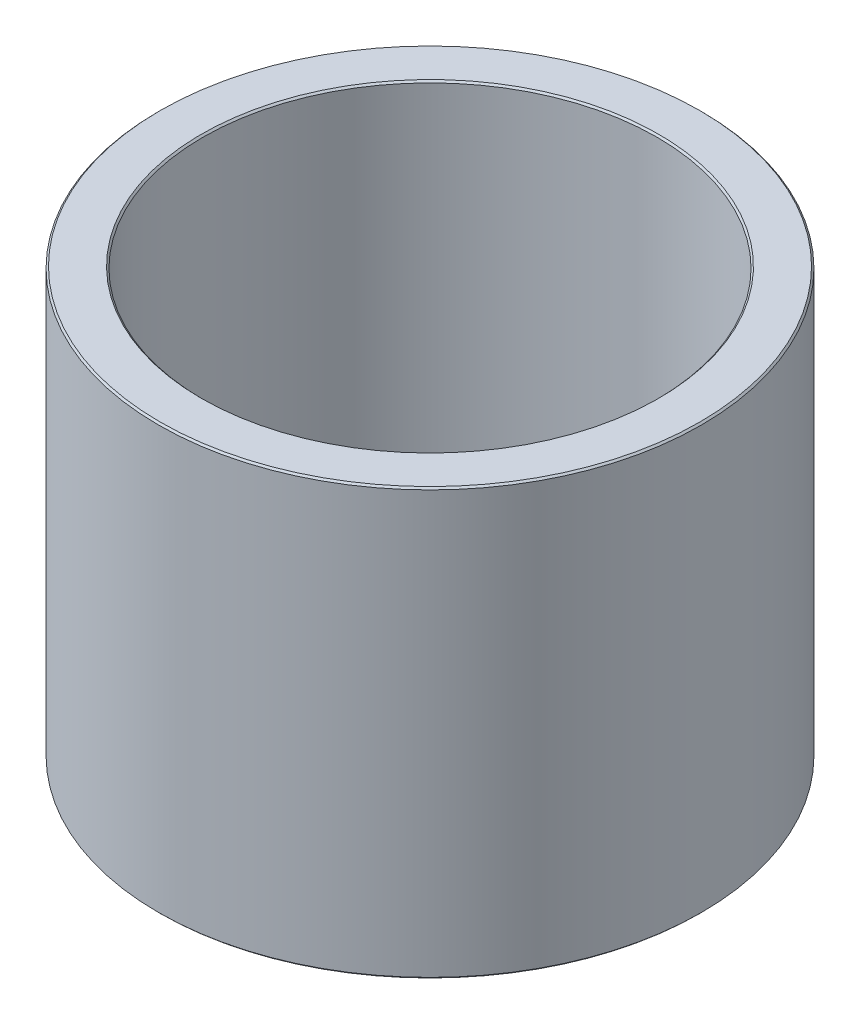
from build123d import *

# Parameters (mm, degrees)
SKETCH1_R           = 50
BOSS_EXTRUDE1_DEPTH = 78.376221586
SKETCH2_R           = 41.811016361
CUT_EXTRUDE1_DEPTH  = 106.559614011
CHAMFER1_SIZE       = 0.312434308


with BuildPart() as part:
    # Sketch1 → Boss-Extrude1 (new body)
    with BuildSketch(Plane(origin=(0, 0, 0), x_dir=(1, 0, 0), z_dir=(0, 1, 0))):
        Circle(SKETCH1_R)
    extrude(amount=BOSS_EXTRUDE1_DEPTH)

    # Sketch2 → Cut-Extrude1 (cut, through all)
    with BuildSketch(Plane(origin=(0, 0, 0), x_dir=(1, 0, 0), z_dir=(0, 1, 0))):
        Circle(SKETCH2_R)
    extrude(amount=CUT_EXTRUDE1_DEPTH, mode=Mode.SUBTRACT)

    # Chamfer1
    chamfer1_edges = [part.edges().sort_by_distance(p)[0] for p in [
        (-41.811016361, 78.376221586, 0),
        (-41.811016361, 0, 0),
        (-50, 0, 0),
        (-50, 78.376221586, 0),
    ]]
    chamfer(chamfer1_edges, length=CHAMFER1_SIZE)


solid = part.part
